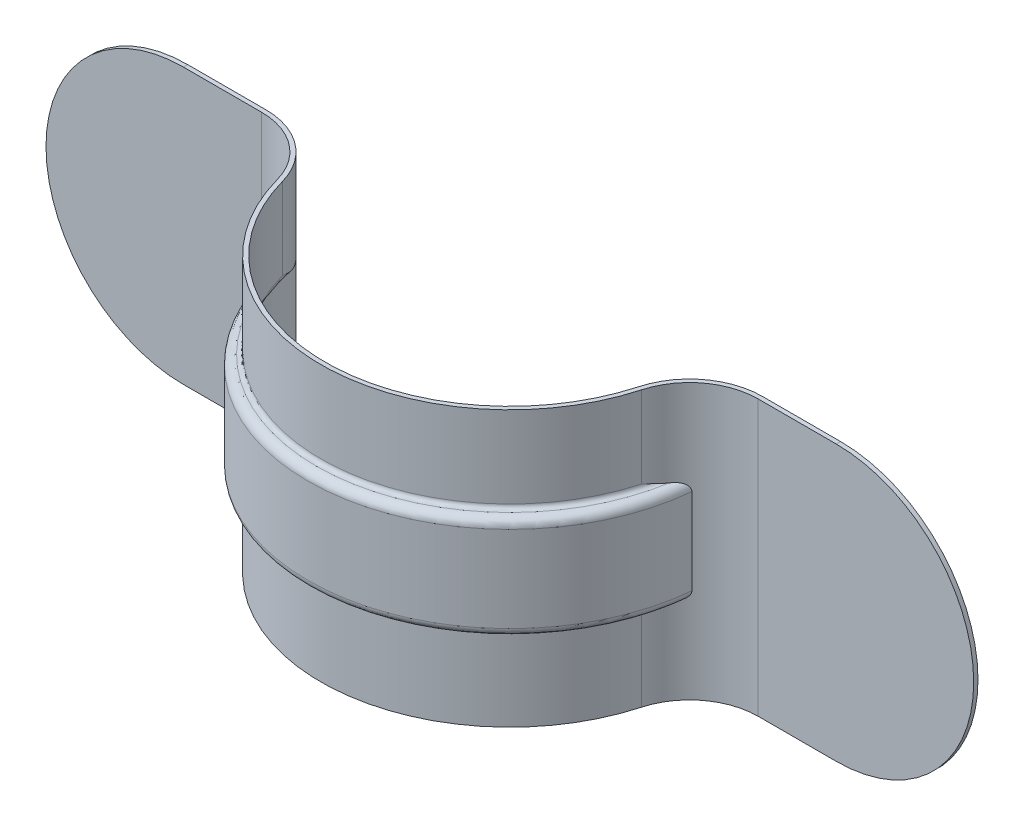
from build123d import *
from build123d.topology import SkipClean

# Parameters (mm, degrees)
BOSS_EXTRUDE1_DEPTH     = 25.4
CUT_EXTRUDE1_DEPTH      = 53.79481804590295
CUT_EXTRUDE2_DEPTH      = 49.43989042913134
CUT_EXTRUDE2_DEPTH_BACK = 49.43989042913134


with BuildPart() as part:
    # Sketch1 → Boss-Extrude1 (new body)
    with BuildSketch(Plane(origin=(0, 0, 0), x_dir=(1, 0, 0), z_dir=(0, 1, 0))):
        with BuildLine():
            Line((-42.8625, 0), (-22.950221267996525, 0))
            ThreePointArc((-22.950221267996525, 0), (-19.105105318292708, -1.29652759646069), (-16.830162263197447, -4.656666666666666))
            ThreePointArc((-16.830162263197447, -4.656666666666666), (1.07e-15, -17.462499999999995), (16.830162263197447, -4.656666666666666))
            ThreePointArc((16.830162263197447, -4.656666666666666), (19.105105318292708, -1.296527596460689), (22.950221267996525, 0))
            Line((22.950221267996525, 0), (42.8625, 0))
            Line((42.8625, 0), (42.8625, 0.396875))
            Line((42.8625, 0.396875), (22.950221267996525, 0.39687500000000053))
            ThreePointArc((22.950221267996525, 0.39687500000000053), (18.86478557143622, -0.9806855712394844), (16.447658575397504, -4.550833333333337))
            ThreePointArc((16.447658575397504, -4.550833333333337), (-2.74e-15, -17.065625), (-16.447658575397508, -4.550833333333334))
            ThreePointArc((-16.447658575397508, -4.550833333333334), (-18.864785571436222, -0.9806855712394862), (-22.950221267996525, 0.396875))
            Line((-22.950221267996525, 0.396875), (-42.8625, 0.396875))
            Line((-42.8625, 0.396875), (-42.8625, 0))
        make_face()
    extrude(amount=BOSS_EXTRUDE1_DEPTH)

    # Sketch2 → Cut-Extrude1 (cut, through all)
    with BuildSketch(Plane.XY):
        with BuildLine():
            ThreePointArc((-42.8625, 12.7), (-39.14275612106915, 21.680256121069153), (-30.162499999999998, 25.4))
            Line((-30.162499999999998, 25.4), (-42.8625, 25.4))
            Line((-42.8625, 25.4), (-42.8625, 12.7))
        make_face()
        with BuildLine():
            ThreePointArc((-30.162499999999998, -1.78e-15), (-39.142756121069155, 3.7197438789308475), (-42.8625, 12.7))
            Line((-42.8625, 12.7), (-42.8625, 0))
            Line((-42.8625, 0), (-30.162499999999998, -1.73e-15))
        make_face()
        with BuildLine():
            ThreePointArc((30.162499999999998, 25.4), (39.14275612106915, 21.680256121069153), (42.8625, 12.700000000000001))
            Line((42.8625, 12.7), (42.8625, 25.4))
            Line((42.8625, 25.4), (30.162499999999998, 25.4))
        make_face()
        with BuildLine():
            Line((30.162499999999998, -1.73e-15), (42.8625, 0))
            Line((42.8625, 0), (42.8625, 12.7))
            ThreePointArc((42.8625, 12.700000000000001), (39.142756121069155, 3.7197438789308457), (30.16249999999999, -5.33e-15))
        make_face()
    extrude(amount=-CUT_EXTRUDE1_DEPTH, mode=Mode.SUBTRACT)

    # Sweep1: sweep along a path in Sketch6
    with SkipClean():  # the faces are left unmerged after this step: merging them gives an invalid solid
        with BuildLine(Plane(origin=(0, 12.7, 0), x_dir=(1, 0, 0), z_dir=(0, 1, 0))) as sweep1_path:
            ThreePointArc((0, -17.4625), (12.347852166, -12.347852166), (17.4625, 0))
            Line((17.4625, 0), (17.4625, 12.7))
        # Sketch5 → Sweep1 (sweep)
        with BuildSketch(Plane(origin=(0, 0, 0), x_dir=(0, 0, -1), z_dir=(1, 0, 0))):
            with BuildLine():
                Line((-17.065624999999997, 7.540624999999992), (-17.065624999999997, 5.000624999999997))
                Line((-17.065624999999997, 5.000624999999997), (-17.4625, 5.000624999999997))
                Line((-17.4625, 5.000624999999997), (-17.4625, 7.540624999999992))
                ThreePointArc((-17.4625, 7.540624999999992), (-17.578741996216586, 7.821258003783406), (-17.859375, 7.9374999999999964))
                ThreePointArc((-17.859375, 7.9374999999999964), (-18.420641007566825, 8.169983992433172), (-18.653124999999996, 8.731249999999996))
                Line((-18.653124999999996, 8.731249999999996), (-18.653125, 16.66875))
                ThreePointArc((-18.653125, 16.66875), (-18.420641007566818, 17.230016007566817), (-17.859375, 17.4625))
                ThreePointArc((-17.859375, 17.4625), (-17.57874199621659, 17.57874199621659), (-17.4625, 17.859375))
                Line((-17.4625, 17.859375), (-17.4625, 20.399375))
                Line((-17.4625, 20.399375), (-17.065624999999997, 20.399375))
                Line((-17.065624999999997, 20.399375), (-17.065624999999997, 17.859375))
                ThreePointArc((-17.065624999999997, 17.859375), (-17.298108992433175, 17.29810899243318), (-17.859374999999996, 17.065624999999997))
                ThreePointArc((-17.859374999999996, 17.065624999999997), (-18.140008003783407, 16.949383003783407), (-18.256249999999998, 16.668749999999996))
                Line((-18.256249999999998, 16.668749999999996), (-18.256249999999998, 8.731249999999996))
                ThreePointArc((-18.256249999999998, 8.731249999999996), (-18.140008003783407, 8.450616996216583), (-17.859374999999996, 8.334374999999996))
                ThreePointArc((-17.859374999999996, 8.334374999999996), (-17.298108992433175, 8.101891007566815), (-17.065624999999997, 7.540624999999992))
            make_face()
        sweep(path=sweep1_path.line)

    # Cut-Sweep1: sweep along a path in Sketch6<3>
    with BuildLine(Plane(origin=(0, 12.7, 0), x_dir=(1, 0, 0), z_dir=(0, 1, 0))) as cut_sweep1_path:
        ThreePointArc((0, -17.4625), (12.347852166, -12.347852166), (17.4625, 0))
        Line((17.4625, 0), (17.4625, 12.7))
    # Sketch10 → Cut-Sweep1 (sweep, cut)
    with BuildSketch(Plane(origin=(0, 0, 0), x_dir=(0, 0, -1), z_dir=(1, 0, 0))):
        with BuildLine():
            Line((-17.065625, 7.5406249999999915), (-17.065625, 0))
            Line((-17.065625, 0), (-10.715624999999998, 0))
            Line((-10.715624999999998, 0), (-10.715625000000001, 25.4))
            Line((-10.715625000000001, 25.4), (-17.065625000000004, 25.4))
            Line((-17.065625000000004, 25.4), (-17.065625, 17.859375))
            ThreePointArc((-17.065625, 17.859375), (-17.29810899243318, 17.298108992433175), (-17.859375000000004, 17.065625))
            ThreePointArc((-17.859375000000004, 17.065625), (-18.140008003783414, 16.94938300378341), (-18.25625, 16.66875))
            Line((-18.25625, 16.66875), (-18.25625, 8.731249999999996))
            ThreePointArc((-18.25625, 8.731249999999996), (-18.14000800378341, 8.450616996216583), (-17.859375, 8.334374999999998))
            ThreePointArc((-17.859375, 8.334374999999998), (-17.29810899243318, 8.101891007566817), (-17.065625, 7.5406249999999915))
        make_face()
    sweep(path=cut_sweep1_path.line, mode=Mode.SUBTRACT)

    # Mirror1: read off the stored shape, not the designer's step
    # Mirror1
    split(bisect_by=Plane(origin=(0, 0, 0), x_dir=(0, 0, 1), z_dir=(1, 0, 0)), keep=Keep.TOP)

    # Mirror1 2: part across plane


with BuildPart() as part_1:
    add(part.part)
    add(part.part.mirror(Plane(origin=(0, 0, 0), x_dir=(0, 0, 1), z_dir=(1, 0, 0))))

    # Sketch7 → Cut-Extrude2 (cut, two sides: drawn at the far end of the back side and taken through both)
    with BuildSketch(Plane(origin=(0, 12.7, 0), x_dir=(1, 0, 0), z_dir=(0, 1, 0)).offset(-CUT_EXTRUDE2_DEPTH_BACK)):
        with BuildLine():
            Line((-22.950221267996525, 0.39687500000000053), (-22.950221267996525, 19.446875000000002))
            Line((-22.950221267996525, 19.446875000000002), (22.950221267996525, 19.446875000000002))
            Line((22.950221267996525, 19.446875000000002), (22.950221267996525, 0.39687500000000053))
            ThreePointArc((22.950221267996525, 0.39687500000000053), (18.86478557143622, -0.9806855712394897), (16.447658575397504, -4.550833333333339))
            ThreePointArc((16.447658575397504, -4.550833333333339), (-6.53e-15, -17.065624999999997), (-16.447658575397508, -4.55083333333333))
            ThreePointArc((-16.447658575397508, -4.55083333333333), (-18.864785571436222, -0.9806855712394835), (-22.950221267996525, 0.39687500000000053))
        make_face()
    extrude(amount=CUT_EXTRUDE2_DEPTH + CUT_EXTRUDE2_DEPTH_BACK, mode=Mode.SUBTRACT)


solid = part_1.part
